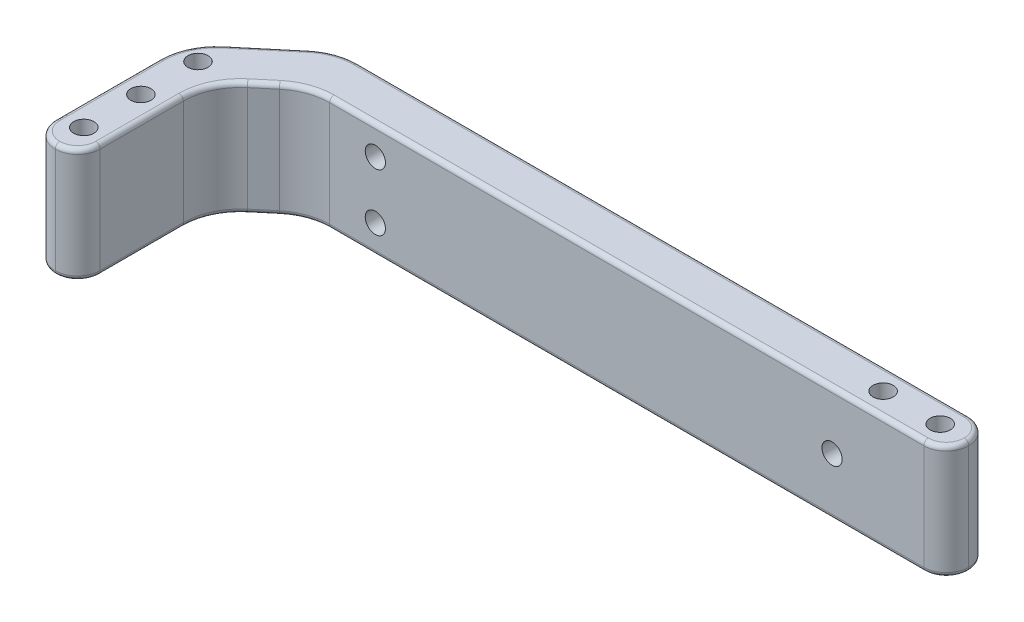
from build123d import *

# Parameters (mm, degrees)
SKETCH1_R           = 2.25
BOSS_EXTRUDE1_DEPTH = 25.4
FILLET2_R           = 5
CUT_EXTRUDE2_REACH  = 170.202
SKETCH3_R           = 2.25
FILLET4_R           = 12.7
FILLET5_R           = 1


with BuildPart() as part:
    # Sketch1 → Boss-Extrude1 (new body)
    # profile 1 of 2: a face of its own
    with BuildSketch(Plane(origin=(0, 0, 0), x_dir=(1, 0, 0), z_dir=(0, 1, 0))):
        Polygon((158.75, 33.1), (158.75, 43.1), (13.315419455, 43.1), (-5, 27.731538291), (-5, -6.35), (5, -6.35), (5, 23.068461709), (5, 33.1), (16.955121797, 33.1), align=None)
        with Locations(Location((0, 0, 0), (0, 0, 270))):
            Circle(SKETCH1_R, mode=Mode.SUBTRACT)
        with Locations(Location((0, 12.7, 0), (0, 0, 270))):
            Circle(SKETCH1_R, mode=Mode.SUBTRACT)
        with Locations(Location((0, 25.4, 0), (0, 0, 270))):
            Circle(SKETCH1_R, mode=Mode.SUBTRACT)
        with Locations(Location((139.7, 38.1, 0), (0, 0, 270))):
            Circle(SKETCH1_R, mode=Mode.SUBTRACT)
        with Locations(Location((152.4, 38.1, 0), (0, 0, 270))):
            Circle(SKETCH1_R, mode=Mode.SUBTRACT)
    # profile 2 of 2: a face of its own
    with BuildSketch(Plane(origin=(0, 0, 0), x_dir=(1, 0, 0), z_dir=(0, 1, 0))):
        Polygon((5, 23.068461709), (16.955121797, 33.1), (5, 33.1), align=None)
    extrude(amount=BOSS_EXTRUDE1_DEPTH)

    # Fillet2
    fillet2_edges = [part.edges().sort_by_distance(p)[0] for p in [
        (-5, 12.7, 6.35),
        (5, 12.7, 6.35),
        (158.75, 12.7, -43.1),
        (158.75, 12.7, -33.1),
    ]]
    fillet(fillet2_edges, radius=FILLET2_R - 0.0001)  # a hair under: the kernel refuses the full size

    # Sketch3 → Cut-Extrude2 (cut, up to next)
    with BuildSketch(Plane(origin=(0, 0, -43.1), x_dir=(-1, 0, 0), z_dir=(0, 0, -1)), mode=Mode.PRIVATE) as cut_extrude2_sk1:
        with Locations((-31.75, 6.35)):
            Circle(SKETCH3_R)
    cut_extrude2_tool1 = extrude(cut_extrude2_sk1.sketch, amount=-CUT_EXTRUDE2_REACH, mode=Mode.PRIVATE) & part.part
    # Sketch3 → Cut-Extrude2 (cut, up to next)
    with BuildSketch(Plane(origin=(0, 0, -43.1), x_dir=(-1, 0, 0), z_dir=(0, 0, -1)), mode=Mode.PRIVATE) as cut_extrude2_sk2:
        with Locations((-31.75, 19.05)):
            Circle(SKETCH3_R)
    cut_extrude2_tool2 = extrude(cut_extrude2_sk2.sketch, amount=-CUT_EXTRUDE2_REACH, mode=Mode.PRIVATE) & part.part
    # Sketch3 → Cut-Extrude2 (cut, up to next)
    with BuildSketch(Plane(origin=(0, 0, -43.1), x_dir=(-1, 0, 0), z_dir=(0, 0, -1)), mode=Mode.PRIVATE) as cut_extrude2_sk3:
        with Locations((-133.35, 12.7)):
            Circle(SKETCH3_R)
    cut_extrude2_tool3 = extrude(cut_extrude2_sk3.sketch, amount=-CUT_EXTRUDE2_REACH, mode=Mode.PRIVATE) & part.part
    add(cut_extrude2_tool1.solids().sort_by_distance((31.75, 6.35, -43.1))[0], mode=Mode.SUBTRACT)
    add(cut_extrude2_tool2.solids().sort_by_distance((31.75, 19.05, -43.1))[0], mode=Mode.SUBTRACT)
    add(cut_extrude2_tool3.solids().sort_by_distance((133.35, 12.7, -43.1))[0], mode=Mode.SUBTRACT)

    # Fillet4
    fillet4_edges = [part.edges().sort_by_distance(p)[0] for p in [
        (-5, 12.7, -27.731538291),
        (13.315419455, 12.7, -43.1),
        (16.955121797, 12.7, -33.1),
        (5, 12.7, -23.068461709),
    ]]
    fillet(fillet4_edges, radius=FILLET4_R)

    # Fillet5
    fillet5_edges = [part.edges().sort_by_distance(p)[0] for p in [
        (-5, 0, -10.229665516),
        (87.663821886, 0, -33.1),
        (157.285563195, 0, -34.564436805),
        (157.285563195, 0, -41.635563195),
        (3.535563195, 0, 4.885563195),
        (-3.535563195, 0, 4.885563195),
        (-5, 25.4, -10.229665516),
        (87.663821886, 25.4, -33.1),
        (157.285563195, 25.4, -34.564436805),
        (157.285563195, 25.4, -41.635563195),
        (3.535563195, 25.4, 4.885563195),
        (-3.535563195, 25.4, 4.885563195),
        (11.475369243, 0, -28.501941653),
        (11.475369243, 25.4, -28.501941653),
        (5, 25.4, -7.898127225),
        (5, 0, -7.898127225),
        (4.655518072, 0, -35.833479944),
        (4.655518072, 25.4, -35.833479944),
        (85.843970715, 0, -43.1),
        (-3.810108895, 0, -27.176682956),
        (13.59418561, 0, -42.334096284),
        (85.843970715, 25.4, -43.1),
        (-3.810108895, 25.4, -27.176682956),
        (13.59418561, 25.4, -42.334096284),
        (17.233887952, 0, -32.334096284),
        (17.233887952, 25.4, -32.334096284),
        (6.189891105, 0, -22.513606375),
        (6.189891105, 25.4, -22.513606375),
    ]]
    fillet(fillet5_edges, radius=FILLET5_R)


solid = part.part
